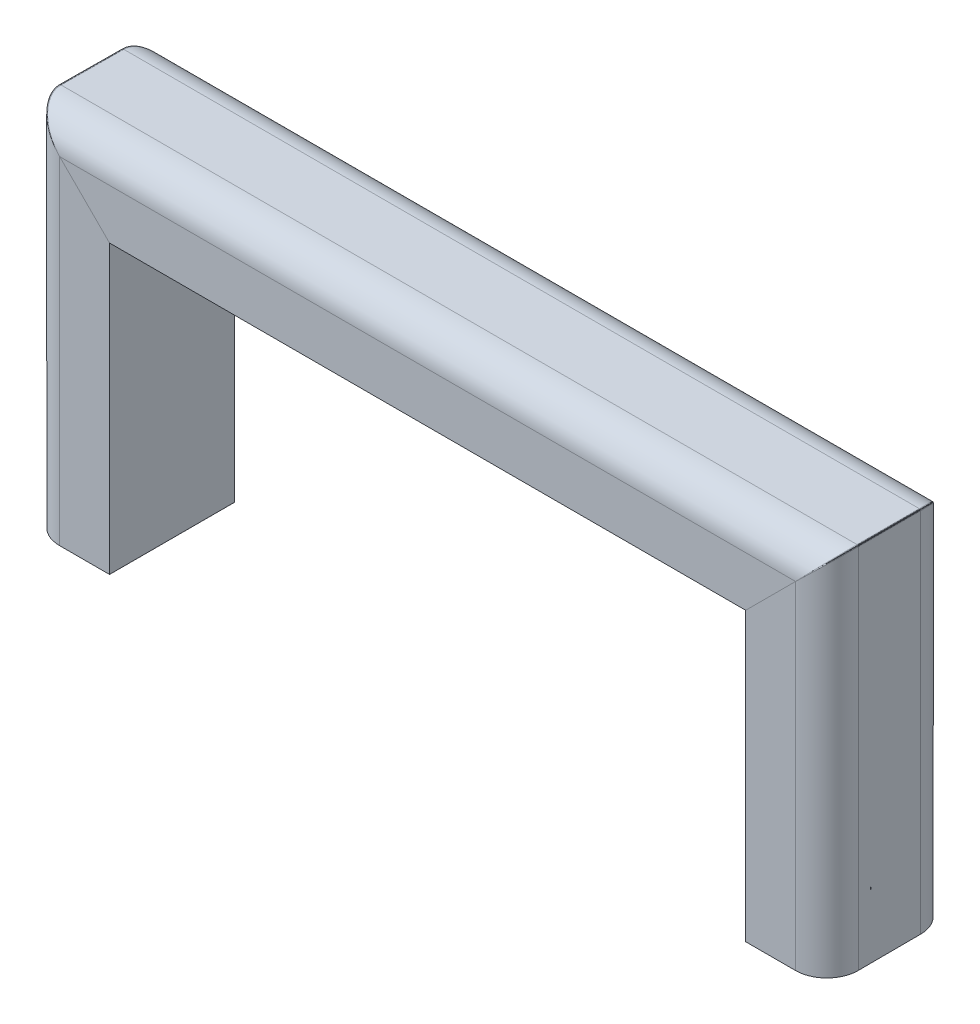
from build123d import *

# Parameters (mm, degrees)
PLYWOOD_DEPTH       = 127
SKETCH2_R           = 31.75
SKETCH2_R_2         = 31.623
BOSS_EXTRUDE2_DEPTH = 0.127
FILLET2_R           = 1.27


with BuildPart() as part:
    # Sketch1 → Plywood (new body)
    with BuildSketch(Plane.XY):
        Polygon((-342.9, 0), (-342.9, 311.15), (342.9, 311.15), (342.9, 0), (323.85, 0), (323.85, 292.1), (-323.85, 292.1), (-323.85, 0), align=None)
    extrude(amount=PLYWOOD_DEPTH)


with BuildPart() as body_2:
    # Sweep1: sweep along a path in Sketch3
    with BuildLine(Plane.XY.offset(95.25)) as sweep1_path:
        Line((-374.65, 0), (-374.65, 342.9))
        Line((-374.65, 342.9), (374.65, 342.9))
        Line((374.65, 342.9), (374.65, 0))
    # Sketch2 → Sweep1 (sweep)
    with BuildSketch(Plane.XZ):
        with Locations((-374.65, 95.25)):
            Circle(SKETCH2_R)
        with Locations((-374.523, 31.623)):
            Circle(SKETCH2_R_2)
    sweep(path=sweep1_path.line, transition=Transition.RIGHT)


with BuildPart() as body_3:
    # Sweep2: sweep along a path in Sketch4
    with BuildLine(Plane.XY.offset(31.623)) as sweep2_path:
        Line((-374.523, 0), (-374.523, 342.9))
        Line((-374.523, 342.9), (374.65, 342.9))
        Line((374.65, 342.9), (374.65, 0))
    # Sketch6 → Sweep2 (sweep)
    with BuildSketch(Plane.XZ):
        with BuildLine():
            Line((-323.85, 127), (-374.650006, 127))
            ThreePointArc((-374.650006, 127), (-397.145409, 117.655786), (-406.399747, 95.12326))
            Line((-406.399747, 95.12326), (-406.145748, 31.496761))
            ThreePointArc((-406.145748, 31.496761), (-396.839161, 9.217574), (-374.523, 0))
            Line((-374.523, 0), (-323.85, 0))
            Line((-323.85, 0), (-323.85, -0.127))
            Line((-323.85, -0.127), (-374.523, -0.127))
            ThreePointArc((-374.523, -0.127), (-396.928784, 9.127593), (-406.272747, 31.496254))
            Line((-406.272747, 31.496254), (-406.526746, 95.122753))
            ThreePointArc((-406.526746, 95.122753), (-397.235391, 117.745409), (-374.650006, 127.127))
            Line((-374.650006, 127.127), (-323.85, 127.127))
            Line((-323.85, 127.127), (-323.85, 127))
        make_face()
    sweep(path=sweep2_path.line, transition=Transition.RIGHT)

    # Sketch7 → Boss-Extrude2 (add)
    with BuildSketch(Plane.XZ):
        with BuildLine():
            Line((-323.85, 127.127), (-374.650006, 127.127))
            ThreePointArc((-374.650006, 127.127), (-397.235391, 117.745409), (-406.526746, 95.122753))
            Line((-406.526746, 95.122753), (-406.272747, 31.496254))
            ThreePointArc((-406.272747, 31.496254), (-396.928784, 9.127593), (-374.523, -0.127))
            Line((-374.523, -0.127), (-323.85, 0))
            Line((-323.85, 0), (-323.85, 127.127))
        make_face()
        with BuildLine():
            Line((323.85, -0.127), (323.85, 127.127))
            Line((323.85, 127.127), (374.777006, 127.127))
            ThreePointArc((374.777006, 127.127), (397.362391, 117.745409), (406.653746, 95.122753))
            Line((406.653746, 95.122753), (406.399747, 31.496254))
            ThreePointArc((406.399747, 31.496254), (397.055784, 9.127593), (374.65, -0.127))
            Line((374.65, -0.127), (323.85, -0.127))
        make_face()
    extrude(amount=BOSS_EXTRUDE2_DEPTH)

    # Fillet2
    fillet2_edges = [body_3.edges().sort_by_distance(p)[0] for p in [
        (-406.526937, 374.903937, 95.18638),
        (-397.190445, 365.567445, 117.790445),
        (-406.399747, 374.776747, 63.309504),
        (-396.928784, 365.305784, 9.127593),
    ]]
    fillet(fillet2_edges, radius=FILLET2_R - 0.0001)  # a hair under: the kernel refuses the full size
    fillet2_2_edges = [body_3.edges().sort_by_distance(p)[0] for p in [
        (397.055784, 365.305784, 9.127593),
        (406.526747, 374.776747, 63.309504),
        (406.653937, 374.903937, 95.18638),
        (397.317445, 365.567445, 117.790445),
    ]]
    fillet(fillet2_2_edges, radius=FILLET2_R - 0.0001)  # a hair under: the kernel refuses the full size


solid = Compound([part.part, body_2.part, body_3.part])
